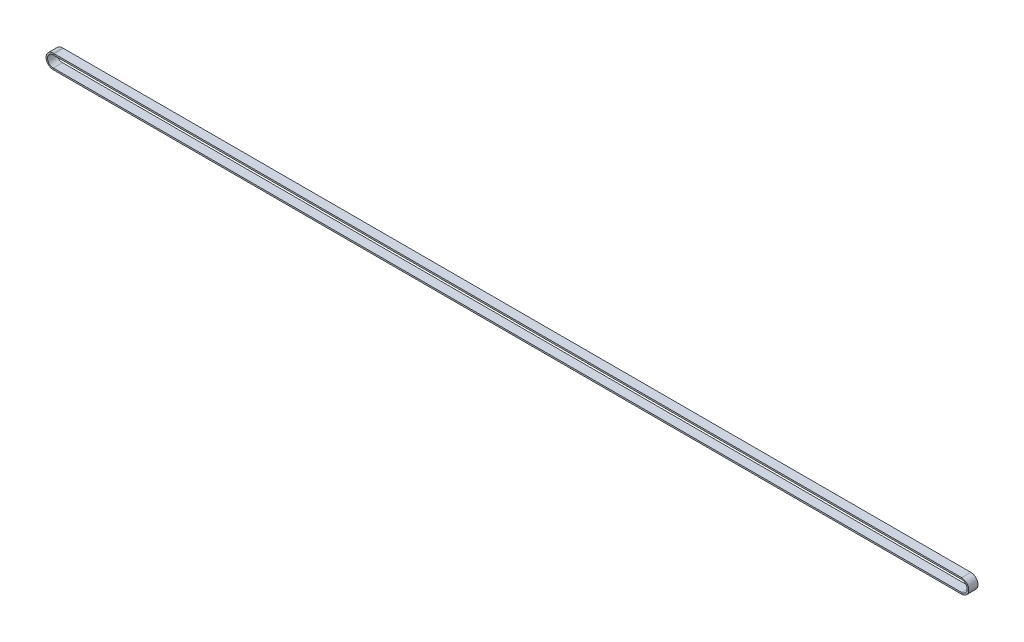
from build123d import *

# Parameters (mm, degrees)
SKETCH3_W = 9
SKETCH3_H = 1.5


with BuildPart() as part:
    # Sweep1: sweep along a path in Sketch2
    with BuildLine(Plane.XY) as sweep1_path:
        Line((-1, -68.182043681), (883.520636904, -68.182043681))
        ThreePointArc((883.520636904, -68.182043681), (890.520636904, -75.182043681), (883.520636904, -82.182043681))
        Line((883.520636904, -82.182043681), (-1, -82.182043681))
        ThreePointArc((-1, -82.182043681), (-8, -75.182043681), (-1, -68.182043681))
    # Sketch3 → Sweep1 (sweep)
    with BuildSketch(Plane(origin=(0, 0, 0), x_dir=(0, 0, -1), z_dir=(1, 0, 0))):
        with Locations((-4.5, -68.932043681)):
            Rectangle(SKETCH3_W, SKETCH3_H)
    sweep(path=sweep1_path.line)


solid = part.part
